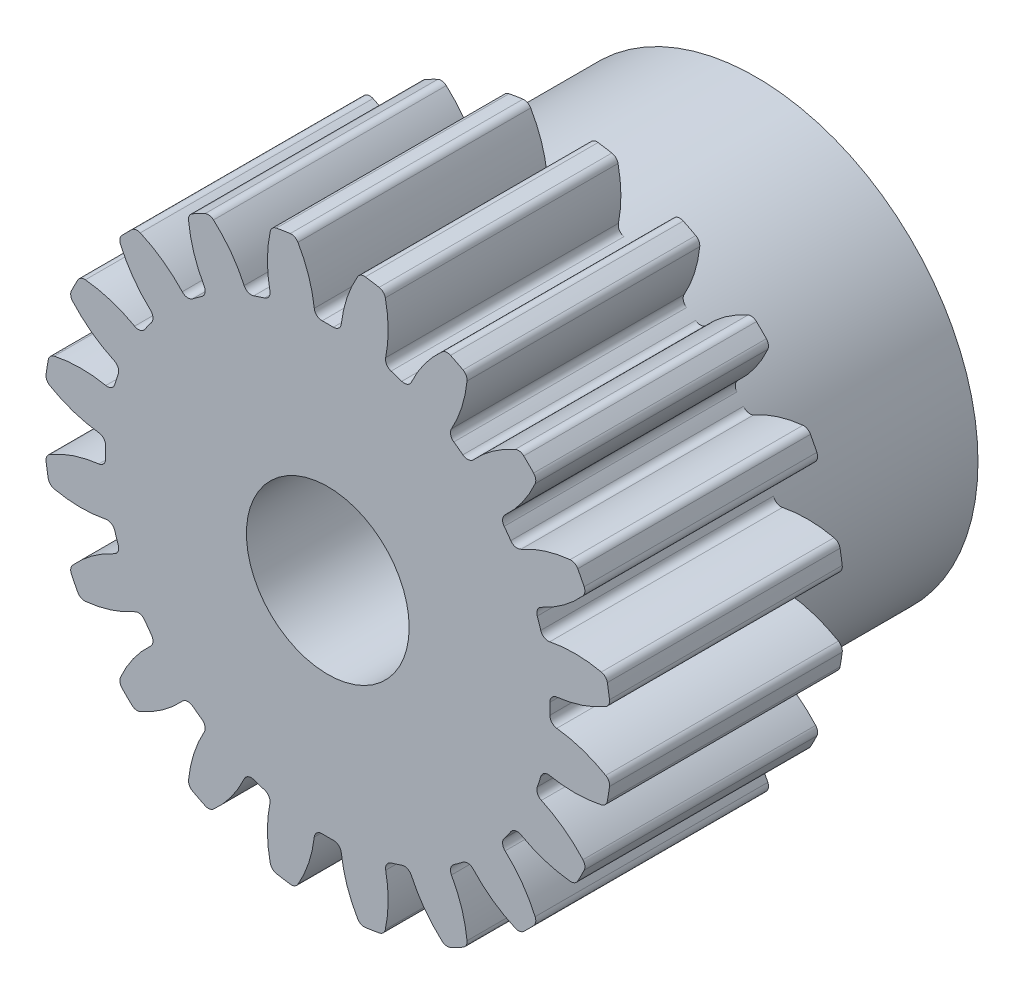
from build123d import *
from build123d.topology import SkipClean

# Parameters (mm, degrees)
SKETCH1_R                = 8.7318
SKETCH1_R_2              = 7.938
SKETCH1_R_3              = 6.82668
SKETCH1_R_4              = 2.5
BOSS_EXTRUDE2_DEPTH      = 7.15
BOSS_EXTRUDE3_START      = -6
SKETCH1_5_R              = 6.82668
SKETCH1_5_R_2            = 2.5
BOSS_EXTRUDE3_DEPTH      = 6
CUT_EXTRUDE1_START       = -7.15
CUT_EXTRUDE1_DEPTH       = 7.15
FILLET1_R                = 0.23814
CIRPATTERN2_COUNT        = 20
FILLET1_OF_CIRPATTERN2_R = 0.23814


with BuildPart() as part:
    # Sketch1 → Boss-Extrude2 (new body)
    # profile 1 of 3: a face of its own
    with BuildSketch(Plane.XY):
        Circle(SKETCH1_R)
        Circle(SKETCH1_R_2, mode=Mode.SUBTRACT)
    # profile 2 of 3: a face of its own
    with BuildSketch(Plane.XY):
        Circle(SKETCH1_R_2)
        Circle(SKETCH1_R_3, mode=Mode.SUBTRACT)
    # profile 3 of 3: a face of its own
    with BuildSketch(Plane.XY):
        Circle(SKETCH1_R_3)
        Circle(SKETCH1_R_4, mode=Mode.SUBTRACT)
    extrude(amount=BOSS_EXTRUDE2_DEPTH)

    # Sketch1<5> → Boss-Extrude3 (add)
    with BuildSketch(Plane.XY.offset(BOSS_EXTRUDE3_START)):
        Circle(SKETCH1_5_R)
        Circle(SKETCH1_5_R_2, mode=Mode.SUBTRACT)
    extrude(amount=BOSS_EXTRUDE3_DEPTH)

    # Sketch4 → Cut-Extrude1 (cut)
    with SkipClean():  # the faces are left unmerged after this step: merging them gives an invalid solid
        with BuildSketch(Plane.XY.offset(7.15).offset(CUT_EXTRUDE1_START)):
            with BuildLine():
                ThreePointArc((0.39608846, 6.815179657), (0.805390734, 8.335320249), (1.786619313, 9.56639549))
                ThreePointArc((1.786619313, 9.56639549), (0, 9.7318), (-1.786619313, 9.56639549))
                ThreePointArc((-1.786619313, 9.56639549), (-0.805390734, 8.335320249), (-0.39608846, 6.815179657))
                ThreePointArc((-0.39608846, 6.815179657), (0, 6.82668), (0.39608846, 6.815179657))
            make_face()
        cut_extrude1 = extrude(amount=CUT_EXTRUDE1_DEPTH, mode=Mode.SUBTRACT)

    # Fillet1
    fillet1_edges = [part.edges().sort_by_distance(p)[0] for p in [
        (0.998895251, 8.674476325, 3.575),
        (0.39608846, 6.815179657, 3.575),
        (-0.998895251, 8.674476325, 3.575),
        (-0.39608846, 6.815179657, 3.575),
    ]]
    fillet(fillet1_edges, radius=FILLET1_R)

    # CirPattern2: Cut-Extrude1 ×20 about axis
    with SkipClean():  # the faces are left unmerged after this step: merging them gives an invalid solid
        cirpattern2_axis = Axis((0, 0, 0), (0, 0, 1))
        for i in range(1, CIRPATTERN2_COUNT):
            add(cut_extrude1.rotate(cirpattern2_axis, i * 360 / CIRPATTERN2_COUNT), mode=Mode.SUBTRACT)

    # Fillet1 of CirPattern2
    fillet1_of_cirpattern2_edges = [part.edges().sort_by_distance(p)[0] for p in [
        (-1.730554764, 8.558592843, 3.575),
        (-1.729303823, 6.604019088, 3.575),
        (-3.63056644, 7.941241626, 3.575),
        (-2.482708844, 6.359222957, 3.575),
        (-4.290606021, 7.604934662, 3.575),
        (-3.685419799, 5.746411117, 3.575),
        (-5.906852489, 6.430662867, 3.575),
        (-4.326304389, 5.280781207, 3.575),
        (-6.430662867, 5.906852489, 3.575),
        (-5.280781207, 4.326304389, 3.575),
        (-7.604934662, 4.290606021, 3.575),
        (-5.746411117, 3.685419799, 3.575),
        (-7.941241626, 3.63056644, 3.575),
        (-6.359222957, 2.482708844, 3.575),
        (-8.558592843, 1.730554764, 3.575),
        (-6.604019088, 1.729303823, 3.575),
        (-8.674476325, 0.998895251, 3.575),
        (-6.815179657, 0.39608846, 3.575),
        (-8.674476325, -0.998895251, 3.575),
        (-6.815179657, -0.39608846, 3.575),
        (-8.558592843, -1.730554764, 3.575),
        (-6.604019088, -1.729303823, 3.575),
        (-7.941241626, -3.63056644, 3.575),
        (-6.359222957, -2.482708844, 3.575),
        (-7.604934662, -4.290606021, 3.575),
        (-5.746411117, -3.685419799, 3.575),
        (-6.430662867, -5.906852489, 3.575),
        (-5.280781207, -4.326304389, 3.575),
        (-5.906852489, -6.430662867, 3.575),
        (-4.326304389, -5.280781207, 3.575),
        (-4.290606021, -7.604934662, 3.575),
        (-3.685419799, -5.746411117, 3.575),
        (-3.63056644, -7.941241626, 3.575),
        (-2.482708844, -6.359222957, 3.575),
        (-1.730554764, -8.558592843, 3.575),
        (-1.729303823, -6.604019088, 3.575),
        (-0.998895251, -8.674476325, 3.575),
        (-0.39608846, -6.815179657, 3.575),
        (0.998895251, -8.674476325, 3.575),
        (0.39608846, -6.815179657, 3.575),
        (1.730554764, -8.558592843, 3.575),
        (1.729303823, -6.604019088, 3.575),
        (3.63056644, -7.941241626, 3.575),
        (2.482708844, -6.359222957, 3.575),
        (4.290606021, -7.604934662, 3.575),
        (3.685419799, -5.746411117, 3.575),
        (5.906852489, -6.430662867, 3.575),
        (4.326304389, -5.280781207, 3.575),
        (6.430662867, -5.906852489, 3.575),
        (5.280781207, -4.326304389, 3.575),
        (7.604934662, -4.290606021, 3.575),
        (5.746411117, -3.685419799, 3.575),
        (7.941241626, -3.63056644, 3.575),
        (6.359222957, -2.482708844, 3.575),
        (8.558592843, -1.730554764, 3.575),
        (6.604019088, -1.729303823, 3.575),
        (8.674476325, -0.998895251, 3.575),
        (6.815179657, -0.39608846, 3.575),
        (8.674476325, 0.998895251, 3.575),
        (6.815179657, 0.39608846, 3.575),
        (8.558592843, 1.730554764, 3.575),
        (6.604019088, 1.729303823, 3.575),
        (7.941241626, 3.63056644, 3.575),
        (6.359222957, 2.482708844, 3.575),
        (7.604934662, 4.290606021, 3.575),
        (5.746411117, 3.685419799, 3.575),
        (6.430662867, 5.906852489, 3.575),
        (5.280781207, 4.326304389, 3.575),
        (5.906852489, 6.430662867, 3.575),
        (4.326304389, 5.280781207, 3.575),
        (4.290606021, 7.604934662, 3.575),
        (3.685419799, 5.746411117, 3.575),
        (3.63056644, 7.941241626, 3.575),
        (2.482708844, 6.359222957, 3.575),
        (1.730554764, 8.558592843, 3.575),
        (1.729303823, 6.604019088, 3.575),
    ]]
    fillet(fillet1_of_cirpattern2_edges, radius=FILLET1_OF_CIRPATTERN2_R)


solid = part.part
